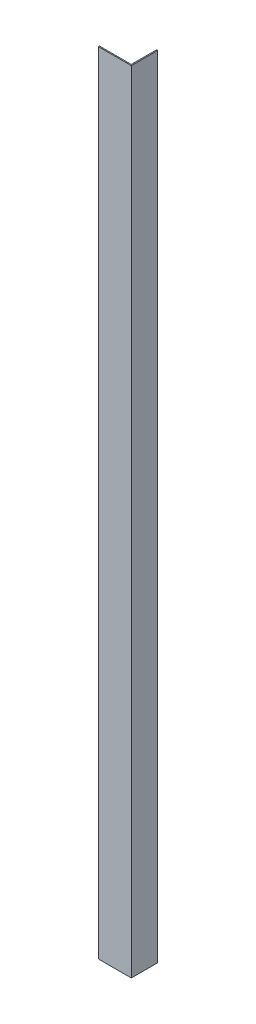
from build123d import *

# Parameters (mm, degrees)
BOSS_EXTRUDE1_DEPTH = 360


with BuildPart() as part:
    # Sketch1 → Boss-Extrude1 (new body)
    with BuildSketch(Plane(origin=(0, 0, 0), x_dir=(1, 0, 0), z_dir=(0, 1, 0))):
        Polygon((0, 0), (15, 0), (15, 12), (14.5, 12), (14.5, 0.5), (0, 0.5), align=None)
    extrude(amount=BOSS_EXTRUDE1_DEPTH)


solid = part.part
